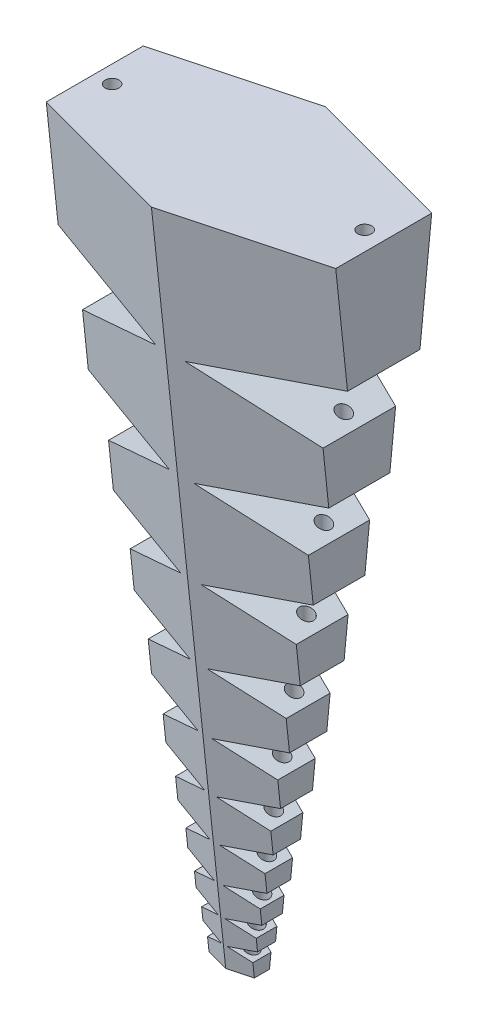
from build123d import *

# Parameters (mm, degrees)
CUT_EXTRUDE2_DEPTH      = 104.832798419
CUT_EXTRUDE2_DEPTH_BACK = 104.832798419
SKETCH17_R              = 1
CUT_EXTRUDE3_DEPTH      = 20
SKETCH22_R              = 1
CUT_EXTRUDE4_DEPTH      = 20
SKETCH23_R              = 1
CUT_EXTRUDE5_DEPTH      = 15
SKETCH24_R              = 1
CUT_EXTRUDE6_DEPTH      = 12
SKETCH25_R              = 1
CUT_EXTRUDE7_DEPTH      = 10
SKETCH26_R              = 1
CUT_EXTRUDE8_DEPTH      = 8
SKETCH27_R              = 1
CUT_EXTRUDE9_DEPTH      = 6
SKETCH28_R              = 1
CUT_EXTRUDE10_DEPTH     = 6
SKETCH29_R              = 1
CUT_EXTRUDE11_DEPTH     = 5
SKETCH30_R              = 1
CUT_EXTRUDE12_DEPTH     = 4
SKETCH16_R              = 1
CUT_EXTRUDE13_DEPTH     = 3


with BuildPart() as part:
    # Sketch2 → Loft1 section 0
    with BuildSketch(Plane(origin=(0, 0, 0), x_dir=(1, 0, 0), z_dir=(0, 1, 0))):
        with BuildLine():
            Line((0.013558001, 1.959309758), (-3.238400261, 1.087950168))
            Line((-3.238400261, 1.087950168), (-3.238400261, -1.087950168))
            Line((-3.238400261, -1.087950168), (0.013558001, -1.959309758))
            Line((0.013558001, -1.959309758), (3.265516264, -1.087950168))
            Line((3.265516264, -1.087950168), (3.265516264, 1.087950168))
            Line((3.265516264, 1.087950168), (0.013558001, 1.959309758))
        make_face()
    # Sketch3 → Loft1 section 1
    with BuildSketch(Plane(origin=(0, 100, 0), x_dir=(1, 0, 0), z_dir=(0, 1, 0))):
        with BuildLine():
            Line((-0.123443963, 12.5), (-25, 5.834346899))
            Line((-25, 5.834346899), (-25, -5.834346899))
            Line((-25, -5.834346899), (-0.123443963, -12.5))
            Line((-0.123443963, -12.5), (24.753112074, -5.834346899))
            Line((24.753112074, -5.834346899), (24.753112074, 5.834346899))
            Line((24.753112074, 5.834346899), (-0.123443963, 12.5))
        make_face()
    loft()

    # spiral_flat → Cut-Extrude2 (cut, two sides: drawn at the far end of the back side and taken through both)
    with BuildSketch(Plane.XY.offset(-CUT_EXTRUDE2_DEPTH_BACK)):
        Polygon((-20.776742097, 100), (-25, 100), (-3.265516264, 0), (-3.265516264, 2.008489475), (-0.392929297, 3.054025626), (-3.929292967, 3.677581955), (-3.929292967, 5.470777811), (-0.472799459, 6.728838563), (-4.727994587, 7.479144272), (-4.727994587, 9.636840421), (-0.568904711, 11.150625338), (-5.689047114, 12.053444588), (-5.689047114, 14.64973247), (-0.684545138, 16.471222227), (-6.84545138, 17.557556223), (-6.84545138, 20.681587736), (-0.823691624, 22.873329044), (-8.236916245, 24.180480559), (-8.236916245, 27.939529377), (-0.991122213, 30.576782728), (-9.911222133, 32.149637014), (-9.911222133, 36.672782174), (-1.192586172, 39.846106147), (-11.925861724, 41.738672218), (-11.925861724, 47.181230462), (-1.435001415, 50.999591347), (-14.35001415, 53.276856548), (-14.35001415, 59.825715627), (-1.726692049, 64.420229129), (-17.266920487, 67.160390689), (-17.266920487, 75.040426751), (-2.07767421, 80.568860277), (-20.776742097, 83.866010459), align=None)
        Polygon((3.265516264, 2.008489475), (3.265516264, 0), (25, 100), (20.776742097, 100), (20.776742097, 83.866010459), (2.07767421, 80.568860277), (17.266920487, 75.040426751), (17.266920487, 67.160390689), (1.726692049, 64.420229129), (14.35001415, 59.825715627), (14.35001415, 53.276856548), (1.435001415, 50.999591347), (11.925861724, 47.181230462), (11.925861724, 41.738672218), (1.192586172, 39.846106147), (9.911222133, 36.672782174), (9.911222133, 32.149637014), (0.991122213, 30.576782728), (8.236916245, 27.939529377), (8.236916245, 24.180480559), (0.823691624, 22.873329044), (6.84545138, 20.681587736), (6.84545138, 17.557556223), (0.684545138, 16.471222227), (5.689047114, 14.64973247), (5.689047114, 12.053444588), (0.568904711, 11.150625338), (4.727994587, 9.636840421), (4.727994587, 7.479144272), (0.472799459, 6.728838563), (3.929292967, 5.470777811), (3.929292967, 3.677581955), (0.392929297, 3.054025626), align=None)
    extrude(amount=CUT_EXTRUDE2_DEPTH + CUT_EXTRUDE2_DEPTH_BACK, mode=Mode.SUBTRACT)

    # Sketch17 → Cut-Extrude3 (cut)
    with BuildSketch(Plane(origin=(0, 100, 0), x_dir=(1, 0, 0), z_dir=(0, 1, 0))):
        with Locations((-18.276742097, 0)):
            Circle(SKETCH17_R)
        with Locations((18.029854171, 0)):
            Circle(SKETCH17_R)
    extrude(amount=-CUT_EXTRUDE3_DEPTH, mode=Mode.SUBTRACT)

    # Sketch22 → Cut-Extrude4 (cut)
    with BuildSketch(Plane(origin=(0, 80.56886028, 0), x_dir=(-1, 0, 0), z_dir=(0, -1, 0))):
        with Locations((15.276742097, 0)):
            Circle(SKETCH22_R)
        with Locations((-15.029854171, 0)):
            Circle(SKETCH22_R)
    extrude(amount=CUT_EXTRUDE4_DEPTH, mode=Mode.SUBTRACT)

    # Sketch23 → Cut-Extrude5 (cut)
    with BuildSketch(Plane(origin=(0, 64.42022913, 0), x_dir=(-1, 0, 0), z_dir=(0, -1, 0))):
        with Locations((12.276742097, 0)):
            Circle(SKETCH23_R)
        with Locations((-12.166856135, 0)):
            Circle(SKETCH23_R)
    extrude(amount=CUT_EXTRUDE5_DEPTH, mode=Mode.SUBTRACT)

    # Sketch24 → Cut-Extrude6 (cut)
    with BuildSketch(Plane(origin=(0, 50.99959135, 0), x_dir=(-1, 0, 0), z_dir=(0, -1, 0))):
        with Locations((9.776742097, 0)):
            Circle(SKETCH24_R)
        with Locations((-9.666856135, 0)):
            Circle(SKETCH24_R)
    extrude(amount=CUT_EXTRUDE6_DEPTH, mode=Mode.SUBTRACT)

    # Sketch25 → Cut-Extrude7 (cut)
    with BuildSketch(Plane(origin=(0, 39.84610615, 0), x_dir=(-1, 0, 0), z_dir=(0, -1, 0))):
        with Locations((7.776742097, 0)):
            Circle(SKETCH25_R)
        with Locations((-7.775843858, 0.118194498)):
            Circle(SKETCH25_R)
    extrude(amount=CUT_EXTRUDE7_DEPTH, mode=Mode.SUBTRACT)

    # Sketch26 → Cut-Extrude8 (cut)
    with BuildSketch(Plane(origin=(0, 30.57678273, 0), x_dir=(-1, 0, 0), z_dir=(0, -1, 0))):
        with Locations((-6.166856135, 0)):
            Circle(SKETCH26_R)
        with Locations((6.276742097, 0)):
            Circle(SKETCH26_R)
    extrude(amount=CUT_EXTRUDE8_DEPTH, mode=Mode.SUBTRACT)

    # Sketch27 → Cut-Extrude9 (cut)
    with BuildSketch(Plane(origin=(0, 22.873329046, 0), x_dir=(-1, 0, 0), z_dir=(0, -1, 0))):
        with Locations((5.076742097, 0)):
            Circle(SKETCH27_R)
        with Locations((-4.966856135, 0)):
            Circle(SKETCH27_R)
    extrude(amount=CUT_EXTRUDE9_DEPTH, mode=Mode.SUBTRACT)

    # Sketch28 → Cut-Extrude10 (cut)
    with BuildSketch(Plane(origin=(0, 16.471222226, 0), x_dir=(-1, 0, 0), z_dir=(0, -1, 0))):
        with Locations((4.076742097, 0)):
            Circle(SKETCH28_R)
        with Locations((-3.966856135, 0)):
            Circle(SKETCH28_R)
    extrude(amount=CUT_EXTRUDE10_DEPTH, mode=Mode.SUBTRACT)

    # Sketch29 → Cut-Extrude11 (cut)
    with BuildSketch(Plane(origin=(0, 11.150625337, 0), x_dir=(-1, 0, 0), z_dir=(0, -1, 0))):
        with Locations((3.276742097, 0)):
            Circle(SKETCH29_R)
        with Locations((-3.276742097, 0)):
            Circle(SKETCH29_R)
    extrude(amount=CUT_EXTRUDE11_DEPTH, mode=Mode.SUBTRACT)

    # Sketch30 → Cut-Extrude12 (cut)
    with BuildSketch(Plane(origin=(0, 6.728838567, 0), x_dir=(-1, 0, 0), z_dir=(0, -1, 0))):
        with Locations((2.476742097, 0)):
            Circle(SKETCH30_R)
        with Locations((-2.476742097, 0)):
            Circle(SKETCH30_R)
    extrude(amount=CUT_EXTRUDE12_DEPTH, mode=Mode.SUBTRACT)

    # Sketch16 → Cut-Extrude13 (cut)
    with BuildSketch(Plane(origin=(0, 0, 0), x_dir=(-1, 0, 0), z_dir=(0, -1, 0))):
        with Locations((1.736441999, 0)):
            Circle(SKETCH16_R)
        with Locations((-1.763558001, 0)):
            Circle(SKETCH16_R)
    extrude(amount=-CUT_EXTRUDE13_DEPTH, mode=Mode.SUBTRACT)


solid = part.part
